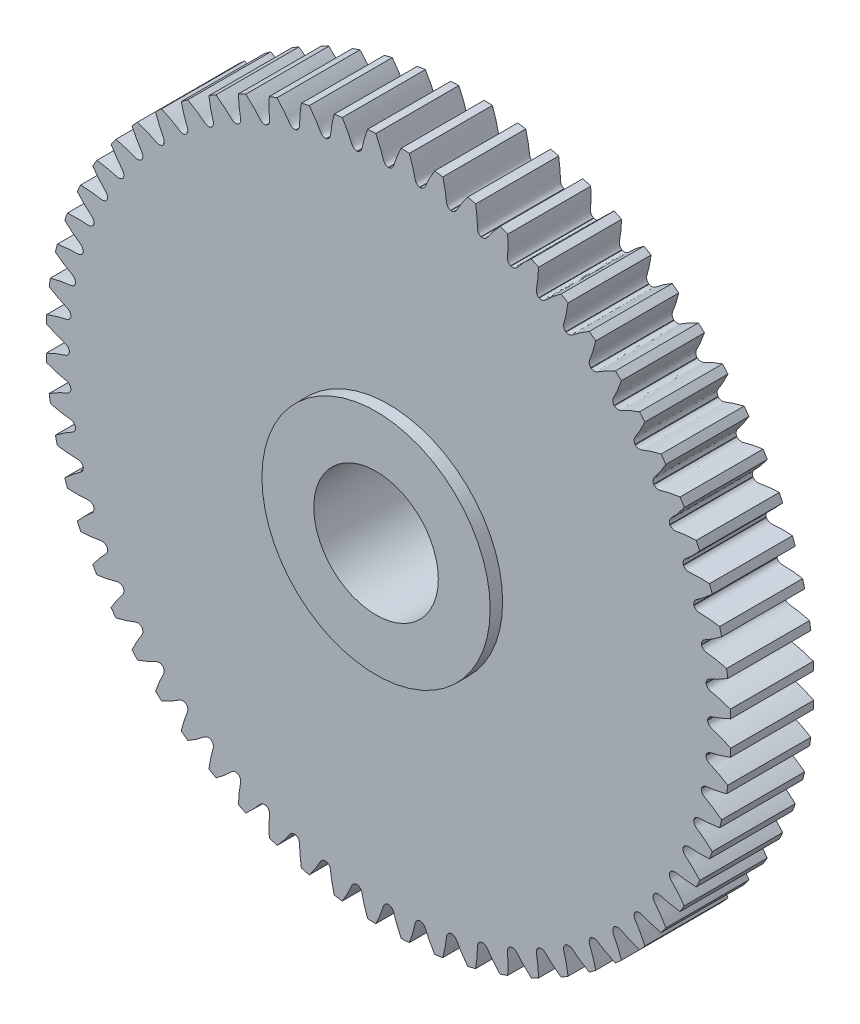
from build123d import *

# Parameters (mm, degrees)
SKETCH_1_R               = 16.5
EXTRUDE_1_DEPTH          = 4
CUT_EXTRUDE_1_DEPTH      = 24.674881204
PATTERN_CIRCULAR_1_COUNT = 64
EXTRUDE_START            = 6
SKETCH_6_R               = 5.5
EXTRUDE_3_DEPTH          = 10.6
SKETCH_7_R               = 3
CUT_EXTRUDE_2_DEPTH      = 26.614633042


with BuildPart() as part:
    # 草图1 → 凸台-拉伸1 (new body)
    with BuildSketch(Plane.XY):
        Circle(SKETCH_1_R)
    extrude(amount=EXTRUDE_1_DEPTH)

    # 草图2 → 切除-拉伸1 (cut, through all)
    with BuildSketch(Plane.XY):
        with BuildLine():
            ThreePointArc((0.01, 15.374949418), (0, 15.37495267), (-0.01, 15.374949418))
            add(Edge.make_bspline(
                [(-0.01, 15.374949418), (-0.215037332, 15.416115456), (-0.250290747, 15.593636045), (-0.31783168, 15.79262662), (-0.351113036, 15.886684995), (-0.388568426, 15.985580928), (-0.430181694, 16.089320748), (-0.476225502, 16.197735216), (-0.52688369, 16.310698101), (-0.582361067, 16.428062625), (-0.642851348, 16.549680016), (-0.70854621, 16.675394282), (-0.779632467, 16.805043848), (-0.856292678, 16.938461222), (-0.938704772, 17.075473241), (-1.02704195, 17.215901146), (-1.121472521, 17.359560716), (-1.222159756, 17.506262391), (-1.32926174, 17.6558114), (-1.442931234, 17.808007891), (-1.563315527, 17.962647073), (-1.690556318, 18.119519349), (-1.824789524, 18.278410463), (-2.01591228, 18.495675884), (-2.166219232, 18.656413505), (-2.269864459, 18.763018025)],
                knots=[0, 0, 0, 0, 0.106355279, 0.129132493, 0.153371243, 0.17907153, 0.206233354, 0.234856715, 0.264941613, 0.296488047, 0.329496018, 0.363965526, 0.399896571, 0.437289153, 0.476143271, 0.516458926, 0.558236118, 0.601474847, 0.646175112, 0.692336914, 0.739960253, 0.789045129, 0.839591542, 0.891599491, 1, 1, 1, 1], degree=3))
            ThreePointArc((-2.269864459, 18.763018025), (0, 18.899818255), (2.269864459, 18.763018025))
            add(Edge.make_bspline(
                [(0.01, 15.374949418), (0.215037332, 15.416115456), (0.250290747, 15.593636045), (0.31783168, 15.79262662), (0.351113036, 15.886684995), (0.388568426, 15.985580928), (0.430181694, 16.089320748), (0.476225502, 16.197735216), (0.52688369, 16.310698101), (0.582361067, 16.428062625), (0.642851348, 16.549680016), (0.70854621, 16.675394282), (0.779632467, 16.805043848), (0.856292678, 16.938461222), (0.938704772, 17.075473241), (1.02704195, 17.215901146), (1.121472521, 17.359560716), (1.222159756, 17.506262391), (1.32926174, 17.6558114), (1.442931234, 17.808007891), (1.563315527, 17.962647073), (1.690556318, 18.119519349), (1.824789524, 18.278410463), (2.01591228, 18.495675884), (2.166219232, 18.656413505), (2.269864459, 18.763018025)],
                knots=[0, 0, 0, 0, 0.106355279, 0.129132493, 0.153371243, 0.17907153, 0.206233354, 0.234856715, 0.264941613, 0.296488047, 0.329496018, 0.363965526, 0.399896571, 0.437289153, 0.476143271, 0.516458926, 0.558236118, 0.601474847, 0.646175112, 0.692336914, 0.739960253, 0.789045129, 0.839591542, 0.891599491, 1, 1, 1, 1], degree=3))
        make_face()
    cut_extrude_1 = extrude(amount=CUT_EXTRUDE_1_DEPTH, mode=Mode.SUBTRACT)

    # 阵列(圆周)1: 切除-拉伸1 ×64 about axis
    pattern_circular_1_axis = Axis((0, 0, -0.15), (0, 0, 1))
    for i in range(1, PATTERN_CIRCULAR_1_COUNT):
        add(cut_extrude_1.rotate(pattern_circular_1_axis, i * 360 / PATTERN_CIRCULAR_1_COUNT), mode=Mode.SUBTRACT)

    # 草图6 → 凸台-拉伸3 (add)
    with BuildSketch(Plane(origin=(0, 0, 0), x_dir=(-1, 0, 0), z_dir=(0, 0, -1)).offset(EXTRUDE_START)):
        Circle(SKETCH_6_R)
    extrude(amount=-EXTRUDE_3_DEPTH)

    # 草图7 → 切除-拉伸2 (cut, through all)
    with BuildSketch(Plane.XY.offset(4.6)):
        Circle(SKETCH_7_R)
    extrude(amount=-CUT_EXTRUDE_2_DEPTH, mode=Mode.SUBTRACT)

    # 草图11 → M4 螺纹孔1 (revolve, cut)
    with BuildSketch(Plane(origin=(0, 0, -3), x_dir=(0, 0, -1), z_dir=(0, 1, 0))):
        Polygon((0, 0), (0, 12.491420021), (1.65, 11.5), (1.65, 0), align=None)
    revolve(axis=Axis((6.35, 0, -3), (-1, 0, 0)), mode=Mode.SUBTRACT)


solid = part.part
